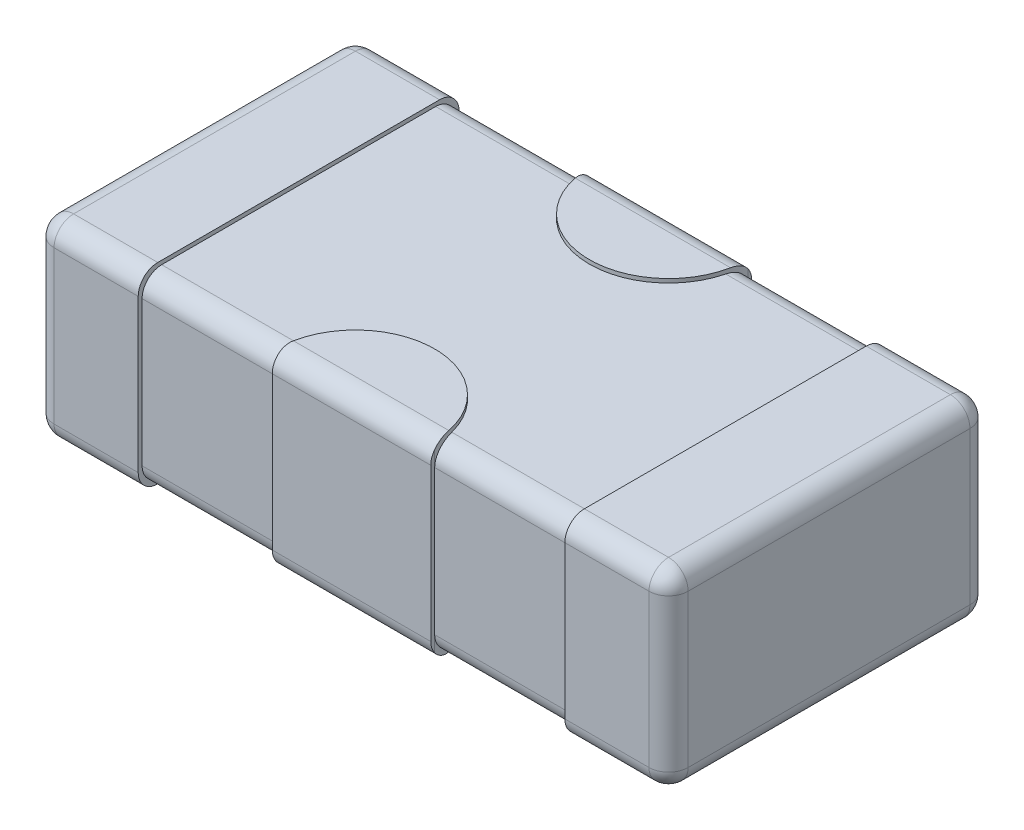
from build123d import *

# Parameters (mm, degrees)
SKETCH1_W           = 3.2
SKETCH1_H           = 1.6
BOSS_EXTRUDE1_DEPTH = 0.94
SKETCH2_W           = 0.53
SKETCH2_H           = 1.64
BOSS_EXTRUDE2_DEPTH = 0.02
BOSS_EXTRUDE3_START = -0.96
SKETCH3_W           = 0.53
SKETCH3_H           = 1.64
BOSS_EXTRUDE3_DEPTH = 0.96
FILLET1_R           = 0.1
FILLET2_START       = -1
FILLET2_DEPTH       = 2


with BuildPart() as part:
    # Sketch1 → Boss-Extrude1 (new body)
    with BuildSketch(Plane(origin=(0, 0, 0), x_dir=(1, 0, 0), z_dir=(0, 1, 0))):
        Rectangle(SKETCH1_W, SKETCH1_H)
    extrude(amount=BOSS_EXTRUDE1_DEPTH)

    # Sketch2 → Boss-Extrude2 (add)
    with BuildSketch(Plane(origin=(0, 0.94, 0), x_dir=(1, 0, 0), z_dir=(0, 1, 0))):
        with BuildLine():
            Line((-0.405, 0.82), (-0.405, 0.8))
            ThreePointArc((-0.405, 0.8), (0, 0.395), (0.405, 0.8))
            Line((0.405, 0.8), (0.405, 0.82))
            Line((0.405, 0.82), (-0.405, 0.82))
        make_face()
        with Locations((-1.355, 0)):
            Rectangle(SKETCH2_W, SKETCH2_H)
        with Locations((1.355, 0)):
            Rectangle(SKETCH2_W, SKETCH2_H)
        with BuildLine():
            Line((-0.405, -0.82), (-0.405, -0.8))
            ThreePointArc((-0.405, -0.8), (0, -0.395), (0.405, -0.8))
            Line((0.405, -0.8), (0.405, -0.82))
            Line((0.405, -0.82), (-0.405, -0.82))
        make_face()
    extrude(amount=BOSS_EXTRUDE2_DEPTH)

    # Sketch3 → Boss-Extrude3 (add)
    with BuildSketch(Plane(origin=(0, 0.94, 0), x_dir=(1, 0, 0), z_dir=(0, 1, 0)).offset(BOSS_EXTRUDE3_START)):
        with Locations((-1.355, 0)):
            Rectangle(SKETCH3_W, SKETCH3_H)
        with BuildLine():
            Line((-0.405, 0.82), (-0.405, 0.8))
            ThreePointArc((-0.405, 0.8), (0, 0.395), (0.405, 0.8))
            Line((0.405, 0.8), (0.405, 0.82))
            Line((0.405, 0.82), (-0.405, 0.82))
        make_face()
        with BuildLine():
            Line((-0.405, -0.8), (-0.405, -0.82))
            Line((-0.405, -0.82), (0.405, -0.82))
            Line((0.405, -0.82), (0.405, -0.8))
            ThreePointArc((0.405, -0.8), (0, -0.395), (-0.405, -0.8))
        make_face()
        with Locations((1.355, 0)):
            Rectangle(SKETCH3_W, SKETCH3_H)
    extrude(amount=BOSS_EXTRUDE3_DEPTH)

    # Fillet1
    # the kernel refuses this fillet: 0.1 mm, written as the material it takes off along each edge
    with BuildSketch(Plane(origin=(1.52, 0.08, 0.72), x_dir=(0, -1, 0), z_dir=(1, 0, 0))) as fillet1_piece_1_section:
        Polygon((0, 0), (FILLET1_R, 0), (FILLET1_R, -FILLET1_R), (0, -FILLET1_R), align=None)
    fillet1_piece_1 = extrude(amount=FILLET1_R, mode=Mode.PRIVATE)
    fillet1_piece_1 = fillet1_piece_1 - Plane(origin=(1.52, 0.08, 0.72), x_dir=(1.184975440516056e-15, 0.7071067811865475, -0.7071067811865475), z_dir=(1, 0, 0)) * Sphere(FILLET1_R, mode=Mode.PRIVATE)
    add(fillet1_piece_1, mode=Mode.SUBTRACT)
    with BuildSketch(Plane(origin=(1.52, 0.08, -0.72), x_dir=(0, 0, -1), z_dir=(1, 0, 0))) as fillet1_piece_2_section:
        Polygon((0, 0), (FILLET1_R, 0), (FILLET1_R, -FILLET1_R), (0, -FILLET1_R), align=None)
    fillet1_piece_2 = extrude(amount=FILLET1_R, mode=Mode.PRIVATE)
    fillet1_piece_2 = fillet1_piece_2 - Plane(origin=(1.52, 0.08, -0.72), x_dir=(0, 0.7071067811865475, 0.7071067811865475), z_dir=(1, 0, 0)) * Sphere(FILLET1_R, mode=Mode.PRIVATE)
    add(fillet1_piece_2, mode=Mode.SUBTRACT)
    with BuildSketch(Plane(origin=(-1.52, 0.08, -0.72), x_dir=(-1, 0, 0), z_dir=(0, 0, -1))) as fillet1_piece_3_section:
        Polygon((0, 0), (FILLET1_R, 0), (FILLET1_R, -FILLET1_R), (0, -FILLET1_R), align=None)
    fillet1_piece_3 = extrude(amount=FILLET1_R, mode=Mode.PRIVATE)
    fillet1_piece_3 = fillet1_piece_3 - Plane(origin=(-1.52, 0.08, -0.72), x_dir=(0.7071067811865475, 0.7071067811865475, 0), z_dir=(0, 0, -1)) * Sphere(FILLET1_R, mode=Mode.PRIVATE)
    add(fillet1_piece_3, mode=Mode.SUBTRACT)
    with BuildSketch(Plane(origin=(-1.52, 0.86, -0.72), x_dir=(-1, 0, 0), z_dir=(0, 0, -1))) as fillet1_piece_4_section:
        Polygon((0, 0), (FILLET1_R, 0), (FILLET1_R, FILLET1_R), (0, FILLET1_R), align=None)
    fillet1_piece_4 = extrude(amount=FILLET1_R, mode=Mode.PRIVATE)
    fillet1_piece_4 = fillet1_piece_4 - Plane(origin=(-1.52, 0.86, -0.72), x_dir=(0.7071067811865475, -0.7071067811865475, 0), z_dir=(0, 0, -1)) * Sphere(FILLET1_R, mode=Mode.PRIVATE)
    add(fillet1_piece_4, mode=Mode.SUBTRACT)
    with BuildSketch(Plane(origin=(-1.52, 0.86, 0.72), x_dir=(0, 1, 0), z_dir=(-1, 0, 0))) as fillet1_piece_5_section:
        Polygon((0, 0), (FILLET1_R, 0), (FILLET1_R, -FILLET1_R), (0, -FILLET1_R), align=None)
    fillet1_piece_5 = extrude(amount=FILLET1_R, mode=Mode.PRIVATE)
    fillet1_piece_5 = fillet1_piece_5 - Plane(origin=(-1.52, 0.86, 0.72), x_dir=(0, -0.7071067811865475, -0.7071067811865475), z_dir=(-1, 0, 0)) * Sphere(FILLET1_R, mode=Mode.PRIVATE)
    add(fillet1_piece_5, mode=Mode.SUBTRACT)
    with BuildSketch(Plane(origin=(-1.52, 0.08, 0.72), x_dir=(0, 0, 1), z_dir=(-1, 0, 0))) as fillet1_piece_6_section:
        Polygon((0, 0), (FILLET1_R, 0), (FILLET1_R, -FILLET1_R), (0, -FILLET1_R), align=None)
    fillet1_piece_6 = extrude(amount=FILLET1_R, mode=Mode.PRIVATE)
    fillet1_piece_6 = fillet1_piece_6 - Plane(origin=(-1.52, 0.08, 0.72), x_dir=(0, 0.7071067811865475, -0.7071067811865475), z_dir=(-1, 0, 0)) * Sphere(FILLET1_R, mode=Mode.PRIVATE)
    add(fillet1_piece_6, mode=Mode.SUBTRACT)
    with BuildSketch(Plane(origin=(1.52, 0.86, 0.72), x_dir=(0, 1, 0), z_dir=(1, 0, 0))) as fillet1_piece_7_section:
        Polygon((0, 0), (FILLET1_R, 0), (FILLET1_R, FILLET1_R), (0, FILLET1_R), align=None)
    fillet1_piece_7 = extrude(amount=FILLET1_R, mode=Mode.PRIVATE)
    fillet1_piece_7 = fillet1_piece_7 - Plane(origin=(1.52, 0.86, 0.72), x_dir=(1.184975440516056e-15, -0.7071067811865475, -0.7071067811865475), z_dir=(1, 0, 0)) * Sphere(FILLET1_R, mode=Mode.PRIVATE)
    add(fillet1_piece_7, mode=Mode.SUBTRACT)
    with BuildSketch(Plane(origin=(1.52, 0.86, -0.72), x_dir=(0, 1, 0), z_dir=(1, 0, 0))) as fillet1_piece_8_section:
        Polygon((0, 0), (FILLET1_R, 0), (FILLET1_R, -FILLET1_R), (0, -FILLET1_R), align=None)
    fillet1_piece_8 = extrude(amount=FILLET1_R, mode=Mode.PRIVATE)
    fillet1_piece_8 = fillet1_piece_8 - Plane(origin=(1.52, 0.86, -0.72), x_dir=(0, -0.7071067811865475, 0.7071067811865475), z_dir=(1, 0, 0)) * Sphere(FILLET1_R, mode=Mode.PRIVATE)
    add(fillet1_piece_8, mode=Mode.SUBTRACT)
    with BuildSketch(Plane(origin=(0.155, 0, -0.8), x_dir=(0, 1, 0), z_dir=(1, 0, 0))) as fillet1_piece_9_section:
        with BuildLine():
            CenterArc((FILLET1_R, FILLET1_R), FILLET1_R, 180, 90)
            Line((0, FILLET1_R), (0, 0))
            Line((0, 0), (FILLET1_R, 0))
        make_face()
    fillet1_piece_9 = extrude(amount=0.935, mode=Mode.PRIVATE)
    fillet1_piece_9 = fillet1_piece_9 - Plane(origin=(0, 0, -0.8), x_dir=(-1, 0, 0), z_dir=(0, -1, 0)) * Cylinder(0.405, 3, mode=Mode.PRIVATE)
    add(fillet1_piece_9, mode=Mode.SUBTRACT)
    with BuildSketch(Plane(origin=(1.62, -0.02, 0.72), x_dir=(0, 1, 0), z_dir=(0, 0, -1)), Plane(origin=(-1.62, 0.96, 0.72), x_dir=(0, -1, 0), z_dir=(0, 0, -1)), Plane(origin=(1.62, 0.96, -0.72), x_dir=(0, -1, 0), z_dir=(0, 0, 1)), Plane(origin=(-1.62, -0.02, -0.72), x_dir=(0, 1, 0), z_dir=(0, 0, 1))) as fillet1_piece_10:
        with BuildLine():
            CenterArc((FILLET1_R, -FILLET1_R), FILLET1_R, 90, 90)
            Line((0, -FILLET1_R), (0, 0))
            Line((0, 0), (FILLET1_R, 0))
        make_face()
    extrude(amount=1.44, mode=Mode.SUBTRACT)
    with BuildSketch(Plane(origin=(0.84, -0.02, 0.82), x_dir=(0, 1, 0), z_dir=(1, 0, 0)), Plane(origin=(1.52, -0.02, -0.82), x_dir=(0, 1, 0), z_dir=(-1, 0, 0)), Plane(origin=(-1.52, 0.96, -0.82), x_dir=(0, -1, 0), z_dir=(1, 0, 0)), Plane(origin=(1.52, 0.96, 0.82), x_dir=(0, -1, 0), z_dir=(-1, 0, 0)), Plane(origin=(-0.84, -0.02, -0.82), x_dir=(0, 1, 0), z_dir=(-1, 0, 0)), Plane(origin=(-1.52, -0.02, 0.82), x_dir=(0, 1, 0), z_dir=(1, 0, 0))) as fillet1_piece_11:
        with BuildLine():
            CenterArc((FILLET1_R, -FILLET1_R), FILLET1_R, 90, 90)
            Line((0, -FILLET1_R), (0, 0))
            Line((0, 0), (FILLET1_R, 0))
        make_face()
    extrude(amount=0.68, mode=Mode.SUBTRACT)
    with BuildSketch(Plane(origin=(-0.155, 0.94, 0.8), x_dir=(0, -1, 0), z_dir=(-1, 0, 0))) as fillet1_piece_12_section:
        with BuildLine():
            CenterArc((FILLET1_R, -FILLET1_R), FILLET1_R, 90, 90)
            Line((0, -FILLET1_R), (0, 0))
            Line((0, 0), (FILLET1_R, 0))
        make_face()
    fillet1_piece_12 = extrude(amount=0.935, mode=Mode.PRIVATE)
    fillet1_piece_12 = fillet1_piece_12 - Plane(origin=(0, 0.94, 0.8), x_dir=(-1, 0, 0), z_dir=(0, -1, 0)) * Cylinder(0.405, 3, mode=Mode.PRIVATE)
    add(fillet1_piece_12, mode=Mode.SUBTRACT)
    with BuildSketch(Plane(origin=(-1.62, 0.08, -0.82), x_dir=(1, 0, 0), z_dir=(0, 1, 0)), Plane(origin=(1.62, 0.08, 0.82), x_dir=(-1, 0, 0), z_dir=(0, 1, 0))) as fillet1_piece_13:
        with BuildLine():
            CenterArc((FILLET1_R, -FILLET1_R), FILLET1_R, 90, 90)
            Line((0, -FILLET1_R), (0, 0))
            Line((0, 0), (FILLET1_R, 0))
        make_face()
    extrude(amount=0.78, mode=Mode.SUBTRACT)
    with BuildSketch(Plane(origin=(-1.62, 0.86, 0.82), x_dir=(0, 0, -1), z_dir=(0, -1, 0)), Plane(origin=(1.62, 0.86, -0.82), x_dir=(0, 0, 1), z_dir=(0, -1, 0))) as fillet1_piece_14:
        with BuildLine():
            CenterArc((FILLET1_R, FILLET1_R), FILLET1_R, 180, 90)
            Line((0, FILLET1_R), (0, 0))
            Line((0, 0), (FILLET1_R, 0))
        make_face()
    extrude(amount=0.78, mode=Mode.SUBTRACT)
    with BuildSketch(Plane(origin=(-0.84, 0.96, 0.82), x_dir=(0, 0, -1), z_dir=(-1, 0, 0)), Plane(origin=(0.84, 0.96, -0.82), x_dir=(0, 0, 1), z_dir=(1, 0, 0))) as fillet1_piece_15:
        with BuildLine():
            CenterArc((FILLET1_R, FILLET1_R), FILLET1_R, 180, 90)
            Line((0, FILLET1_R), (0, 0))
            Line((0, 0), (FILLET1_R, 0))
        make_face()
    extrude(amount=0.68, mode=Mode.SUBTRACT)
    with BuildSketch(Plane(origin=(-1.09, 0.94, -0.8), x_dir=(0, -1, 0), z_dir=(1, 0, 0))) as fillet1_piece_16_section:
        with BuildLine():
            CenterArc((FILLET1_R, -FILLET1_R), FILLET1_R, 90, 90)
            Line((0, -FILLET1_R), (0, 0))
            Line((0, 0), (FILLET1_R, 0))
        make_face()
    fillet1_piece_16 = extrude(amount=0.935, mode=Mode.PRIVATE)
    fillet1_piece_16 = fillet1_piece_16 - Plane(origin=(0, 0.94, -0.8), x_dir=(-1, 0, 0), z_dir=(0, -1, 0)) * Cylinder(0.405, 3, mode=Mode.PRIVATE)
    add(fillet1_piece_16, mode=Mode.SUBTRACT)
    with BuildSketch(Plane(origin=(0.155, 0.94, -0.8), x_dir=(0, -1, 0), z_dir=(1, 0, 0))) as fillet1_piece_17_section:
        with BuildLine():
            CenterArc((FILLET1_R, -FILLET1_R), FILLET1_R, 90, 90)
            Line((0, -FILLET1_R), (0, 0))
            Line((0, 0), (FILLET1_R, 0))
        make_face()
    fillet1_piece_17 = extrude(amount=0.935, mode=Mode.PRIVATE)
    fillet1_piece_17 = fillet1_piece_17 - Plane(origin=(0, 0.94, -0.8), x_dir=(-1, 0, 0), z_dir=(0, -1, 0)) * Cylinder(0.405, 3, mode=Mode.PRIVATE)
    add(fillet1_piece_17, mode=Mode.SUBTRACT)
    with BuildSketch(Plane(origin=(1.09, 0.94, 0.8), x_dir=(0, -1, 0), z_dir=(-1, 0, 0))) as fillet1_piece_18_section:
        with BuildLine():
            CenterArc((FILLET1_R, -FILLET1_R), FILLET1_R, 90, 90)
            Line((0, -FILLET1_R), (0, 0))
            Line((0, 0), (FILLET1_R, 0))
        make_face()
    fillet1_piece_18 = extrude(amount=0.935, mode=Mode.PRIVATE)
    fillet1_piece_18 = fillet1_piece_18 - Plane(origin=(0, 0.94, 0.8), x_dir=(-1, 0, 0), z_dir=(0, -1, 0)) * Cylinder(0.405, 3, mode=Mode.PRIVATE)
    add(fillet1_piece_18, mode=Mode.SUBTRACT)
    with BuildSketch(Plane(origin=(-0.155, 0, 0.8), x_dir=(0, 1, 0), z_dir=(-1, 0, 0))) as fillet1_piece_19_section:
        with BuildLine():
            CenterArc((FILLET1_R, FILLET1_R), FILLET1_R, 180, 90)
            Line((0, FILLET1_R), (0, 0))
            Line((0, 0), (FILLET1_R, 0))
        make_face()
    fillet1_piece_19 = extrude(amount=0.935, mode=Mode.PRIVATE)
    fillet1_piece_19 = fillet1_piece_19 - Plane(origin=(0, 0, 0.8), x_dir=(1, 0, 0), z_dir=(0, -1, 0)) * Cylinder(0.405, 3, mode=Mode.PRIVATE)
    add(fillet1_piece_19, mode=Mode.SUBTRACT)
    with BuildSketch(Plane(origin=(-1.09, 0, -0.8), x_dir=(0, 1, 0), z_dir=(1, 0, 0))) as fillet1_piece_20_section:
        with BuildLine():
            CenterArc((FILLET1_R, FILLET1_R), FILLET1_R, 180, 90)
            Line((0, FILLET1_R), (0, 0))
            Line((0, 0), (FILLET1_R, 0))
        make_face()
    fillet1_piece_20 = extrude(amount=0.935, mode=Mode.PRIVATE)
    fillet1_piece_20 = fillet1_piece_20 - Plane(origin=(0, 0, -0.8), x_dir=(-1, 0, 0), z_dir=(0, -1, 0)) * Cylinder(0.405, 3, mode=Mode.PRIVATE)
    add(fillet1_piece_20, mode=Mode.SUBTRACT)
    with BuildSketch(Plane(origin=(1.09, 0, 0.8), x_dir=(0, 1, 0), z_dir=(-1, 0, 0))) as fillet1_piece_21_section:
        with BuildLine():
            CenterArc((FILLET1_R, FILLET1_R), FILLET1_R, 180, 90)
            Line((0, FILLET1_R), (0, 0))
            Line((0, 0), (FILLET1_R, 0))
        make_face()
    fillet1_piece_21 = extrude(amount=0.935, mode=Mode.PRIVATE)
    fillet1_piece_21 = fillet1_piece_21 - Plane(origin=(0, 0, 0.8), x_dir=(1, 0, 0), z_dir=(0, -1, 0)) * Cylinder(0.405, 3, mode=Mode.PRIVATE)
    add(fillet1_piece_21, mode=Mode.SUBTRACT)

    # Fillet2: read off the stored shape, not the designer's step
    # Fillet2 outline → Fillet2 (cut)
    with BuildSketch(Plane.YZ.offset(FILLET2_START)):
        with BuildLine():
            Line((0.96, 0.82), (0.86, 0.82))
            ThreePointArc((0.86, 0.82), (0.930710678, 0.790710678), (0.96, 0.72))
            Line((0.96, 0.72), (0.96, 0.82))
        make_face()
        with BuildLine():
            ThreePointArc((-0.02, 0.72), (0.009289322, 0.790710678), (0.08, 0.82))
            Line((0.08, 0.82), (-0.02, 0.82))
            Line((-0.02, 0.82), (-0.02, 0.72))
        make_face()
        with BuildLine():
            Line((-0.02, -0.82), (0.08, -0.82))
            ThreePointArc((0.08, -0.82), (0.009289322, -0.790710678), (-0.02, -0.72))
            Line((-0.02, -0.72), (-0.02, -0.82))
        make_face()
        with BuildLine():
            ThreePointArc((0.96, -0.72), (0.930710678, -0.790710678), (0.86, -0.82))
            Line((0.86, -0.82), (0.96, -0.82))
            Line((0.96, -0.82), (0.96, -0.72))
        make_face()
    extrude(amount=FILLET2_DEPTH, mode=Mode.SUBTRACT)


solid = part.part
